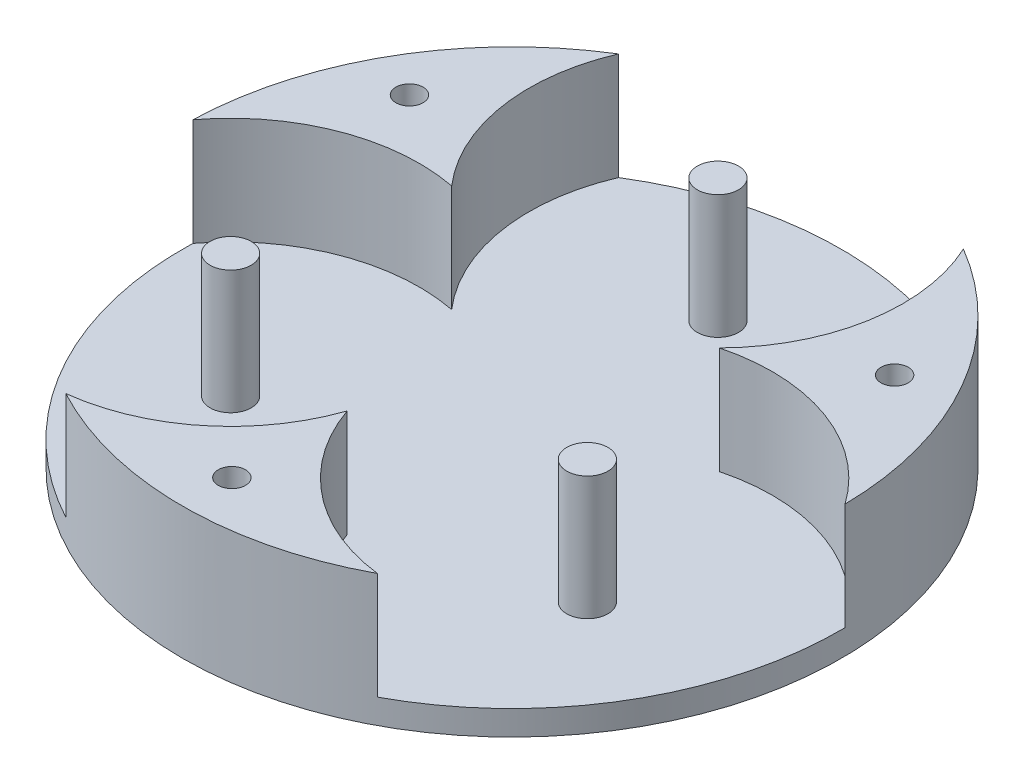
from build123d import *

# Parameters (mm, degrees)
SKETCH3_R               = 40
BOSS_EXTRUDE1_DEPTH     = 3
SKETCH4_R               = 2.5
BOSS_EXTRUDE2_DEPTH     = 15
BOSS_EXTRUDE4_DEPTH     = 13
CUT_EXTRUDE4_DEPTH      = 13
CUT_EXTRUDE4_DEPTH_BACK = 13
SKETCH7_R               = 1.65


with BuildPart() as part:
    # Sketch3 → Boss-Extrude1 (new body)
    with BuildSketch(Plane(origin=(0, 0, 0), x_dir=(1, 0, 0), z_dir=(0, 1, 0))):
        Circle(SKETCH3_R)
    extrude(amount=BOSS_EXTRUDE1_DEPTH)

    # Sketch4 → Boss-Extrude2 (add)
    with BuildSketch(Plane(origin=(0, 3, 0), x_dir=(1, 0, 0), z_dir=(0, 1, 0))):
        with Locations((0, 25)):
            Circle(SKETCH4_R)
        with Locations((21.650635095, -12.5)):
            Circle(SKETCH4_R)
        with Locations((-21.650635095, -12.5)):
            Circle(SKETCH4_R)
    extrude(amount=BOSS_EXTRUDE2_DEPTH)

    # Sketch6 → Boss-Extrude4 (add)
    with BuildSketch(Plane(origin=(0, 3, 0), x_dir=(1, 0, 0), z_dir=(0, 1, 0))):
        with BuildLine():
            ThreePointArc((20.372257649, 34.423409452), (22.109312713, 21.126007388), (15.954610437, 9.211398631))
            ThreePointArc((15.954610437, 9.211398631), (29.350315435, 8.584222776), (39.997675895, 0.43118793))
            ThreePointArc((39.997675895, 0.43118793), (34.641016151, 20), (20.372257649, 34.423409452))
        make_face()
        with BuildLine():
            ThreePointArc((0, -20), (-7.267634053, -30.336178992), (-18.909209976, -35.248287591))
            ThreePointArc((-18.909209976, -35.248287591), (0, -40), (18.909209976, -35.248287591))
            ThreePointArc((18.909209976, -35.248287591), (7.267634053, -30.336178992), (0, -20))
        make_face()
        with BuildLine():
            ThreePointArc((-17.320508076, 10), (-22.638084634, 21.462045211), (-21.071307506, 34))
            ThreePointArc((-21.071307506, 34), (-34.641016151, 20), (-39.980517482, 1.248287591))
            ThreePointArc((-39.980517482, 1.248287591), (-29.905718687, 8.874133781), (-17.320508076, 10))
        make_face()
    extrude(amount=BOSS_EXTRUDE4_DEPTH)

    # Sketch7 → Cut-Extrude4 (cut, two sides: drawn at the far end of the back side and taken through both)
    with BuildSketch(Plane(origin=(0, 3, 0), x_dir=(1, 0, 0), z_dir=(0, 1, 0)).offset(-CUT_EXTRUDE4_DEPTH_BACK)):
        with Locations((0, -34)):
            Circle(SKETCH7_R)
        with Locations((-29.444863729, 17)):
            Circle(SKETCH7_R)
        with Locations((29.444863729, 17)):
            Circle(SKETCH7_R)
    extrude(amount=CUT_EXTRUDE4_DEPTH + CUT_EXTRUDE4_DEPTH_BACK, mode=Mode.SUBTRACT)


solid = part.part
